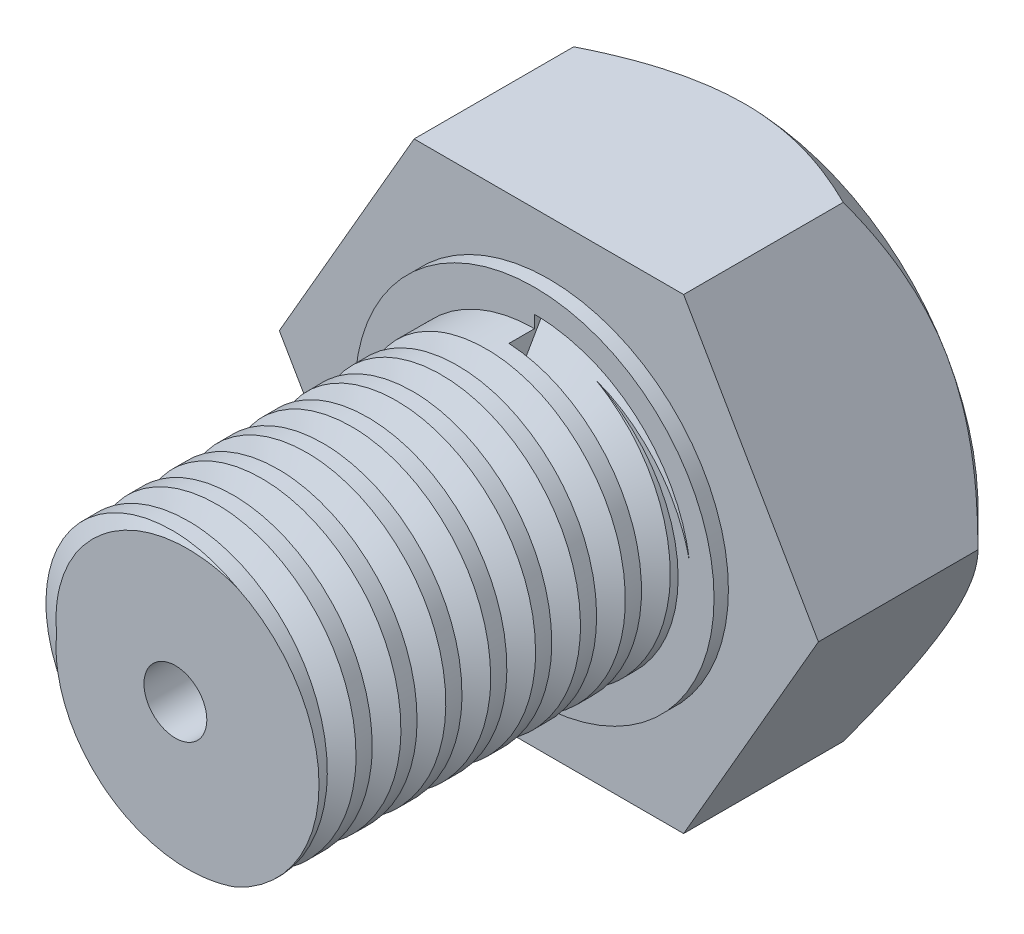
from build123d import *

# Parameters (mm, degrees)
SALIENTE_EXTRUIR4_DEPTH = 5.45
CROQUIS10_R             = 5
SALIENTE_EXTRUIR5_DEPTH = 0.4
CROQUIS11_R             = 4
SALIENTE_EXTRUIR6_DEPTH = 10
CORTAR_BARRER5_PITCH    = 1.25
CROQUIS19_OUTSIDE_W     = 61.5
CROQUIS19_OUTSIDE_H     = 59.488
CROQUIS19_OUTSIDE_R     = 6.5
CORTAR_EXTRUIR4_DEPTH   = 19.703096976
CORTAR_EXTRUIR4_DRAFT   = -45
CROQUIS20_R             = 0.875
CORTAR_EXTRUIR5_DEPTH   = 19.703096976


with BuildPart() as part:
    # Croquis9 → Saliente-Extruir4 (new body)
    with BuildSketch(Plane.XY):
        Polygon((-7.505553499, 0), (-3.75277675, -6.5), (3.75277675, -6.5), (7.505553499, 0), (3.75277675, 6.5), (-3.75277675, 6.5), align=None)
    extrude(amount=SALIENTE_EXTRUIR4_DEPTH)

    # Croquis10 → Saliente-Extruir5 (add)
    with BuildSketch(Plane.XY.offset(5.45)):
        Circle(CROQUIS10_R)
    extrude(amount=SALIENTE_EXTRUIR5_DEPTH)

    # Croquis11 → Saliente-Extruir6 (add)
    with BuildSketch(Plane.XY.offset(5.85)):
        Circle(CROQUIS11_R)
    extrude(amount=SALIENTE_EXTRUIR6_DEPTH)

    # Cortar-Barrer5: arcs per turn and ends read off the stored shape
    # Cortar-Barrer5: the profile of Croquis16 screwed along a left-hand helix through 8.25 turns, 8 arcs to a turn; built about Z, then put on its axis
    cortar_barrer5_z = Axis((0, 0, 0), (0, 0, 1))
    cortar_barrer5_corners = [(0, -3.307179679, 0.312493658), (0, -4.346410164, -0.287506342), (0, -4.346410164, 0.912493658)]
    with BuildLine(mode=Mode.PRIVATE) as cortar_barrer5_profile:
        Line(cortar_barrer5_corners[0], cortar_barrer5_corners[1])
        Line(cortar_barrer5_corners[1], cortar_barrer5_corners[2])
        Line(cortar_barrer5_corners[2], cortar_barrer5_corners[0])
    cortar_barrer5_cap = Face(cortar_barrer5_profile.wire())
    cortar_barrer5_turn_angles = [0, -22.5, -45, -67.5, -90, -112.5, -135, -157.5, -180, -202.5, -225, -247.5, -270, -292.5, -315, -337.5, -360]
    cortar_barrer5_turn_weights = [1, 0.9238795325112867, 1, 0.9238795325112867, 1, 0.9238795325112867, 1, 0.9238795325112867, 1, 0.9238795325112867, 1, 0.9238795325112867, 1, 0.9238795325112867, 1, 0.9238795325112867, 1]
    cortar_barrer5_turn_rails = [Edge.make_bspline([Vector(p[0], p[1], 0).rotate(cortar_barrer5_z, cortar_barrer5_turn_angles[k]) / cortar_barrer5_turn_weights[k] + Vector(0, 0, p[2] + -CORTAR_BARRER5_PITCH * cortar_barrer5_turn_angles[k] / 360) for k in range(17)], [0, 0, 0, 1, 1, 2, 2, 3, 3, 4, 4, 5, 5, 6, 6, 7, 7, 8, 8, 8], 2, cortar_barrer5_turn_weights) for p in cortar_barrer5_corners]
    cortar_barrer5_turn_sides = [Face.make_surface_from_curves(cortar_barrer5_turn_rails[p[0]], cortar_barrer5_turn_rails[p[1]]) for p in [(0, 1), (1, 2), (2, 0)]]
    cortar_barrer5_last_angles = [-2880, -2902.5, -2925, -2947.5, -2970]
    cortar_barrer5_last_weights = [1, 0.9238795325112867, 1, 0.9238795325112867, 1]
    cortar_barrer5_last_rails = [Edge.make_bspline([Vector(p[0], p[1], 0).rotate(cortar_barrer5_z, cortar_barrer5_last_angles[k]) / cortar_barrer5_last_weights[k] + Vector(0, 0, p[2] + -CORTAR_BARRER5_PITCH * cortar_barrer5_last_angles[k] / 360) for k in range(5)], [0, 0, 0, 1, 1, 2, 2, 2], 2, cortar_barrer5_last_weights) for p in cortar_barrer5_corners]
    cortar_barrer5_last_sides = [Face.make_surface_from_curves(cortar_barrer5_last_rails[p[0]], cortar_barrer5_last_rails[p[1]]) for p in [(0, 1), (1, 2), (2, 0)]]
    cortar_barrer5 = Plane(origin=(0, 0, 5.85), x_dir=(-1, 0, 0), z_dir=(0, 0, 1)) * Solid(Shell([*[p.moved(Location((0, 0, CORTAR_BARRER5_PITCH * i))) for i in range(8) for p in cortar_barrer5_turn_sides], *cortar_barrer5_last_sides, cortar_barrer5_cap, cortar_barrer5_cap.rotate(cortar_barrer5_z, -2970).moved(Location((0, 0, -CORTAR_BARRER5_PITCH * -2970 / 360)))]))
    add(cortar_barrer5, mode=Mode.SUBTRACT)


with BuildPart() as cortar_extruir4_tool:
    # Croquis19 outside → Cortar-Extruir4 (with draft: the straight prism first)
    with BuildSketch(Plane(origin=(0, 0, 0), x_dir=(-1, 0, 0), z_dir=(0, 0, -1))):
        Rectangle(CROQUIS19_OUTSIDE_W, CROQUIS19_OUTSIDE_H)
        Circle(CROQUIS19_OUTSIDE_R, mode=Mode.SUBTRACT)
    extrude(amount=-CORTAR_EXTRUIR4_DEPTH)
    # Cortar-Extruir4: the draft: its side faces are tilted about the plane it starts from
    cortar_extruir4_sides = [cortar_extruir4_tool.faces().sort_by_distance(p)[0] for p in [
        (0, -29.744, 9.851548488),
        (-30.75, 0, 9.851548488),
        (0, 29.744, 9.851548488),
        (30.75, 0, 9.851548488),
        (6.5, 0, 9.851548488),
    ]]
    draft(cortar_extruir4_sides, Plane(origin=(0, 0, 0), x_dir=(-1, 0, 0), z_dir=(0, 0, -1)), CORTAR_EXTRUIR4_DRAFT)


with BuildPart() as part_1:
    add(part.part)

    # Cortar-Extruir4: cut by cortar_extruir4_tool
    add(cortar_extruir4_tool.part, mode=Mode.SUBTRACT)

    # Croquis20 → Cortar-Extruir5 (cut, through all)
    with BuildSketch(Plane(origin=(0, 0, 0), x_dir=(-1, 0, 0), z_dir=(0, 0, -1))):
        Circle(CROQUIS20_R)
    extrude(amount=-CORTAR_EXTRUIR5_DEPTH, mode=Mode.SUBTRACT)


solid = part_1.part
